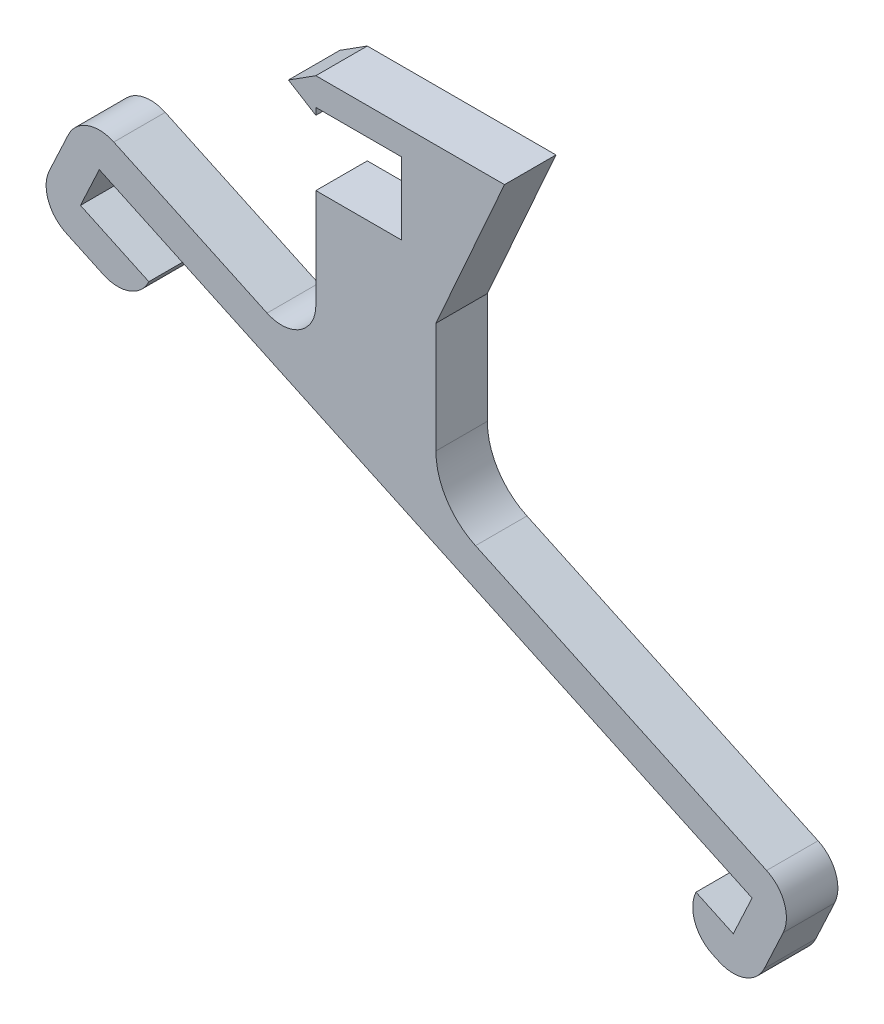
from build123d import *

# Parameters (mm, degrees)
BOSS_EXTRUDE1_DEPTH = 15
FILLET1_R           = 10
FILLET2_R           = 20


with BuildPart() as part:
    # Sketch1 → Boss-Extrude1 (new body)
    with BuildSketch(Plane.XY):
        Polygon((0, 0), (-25, 0), (-25, -2), (-33, 2.914001084), (-25, 8), (10, 8), (30, 8), (10, -37), (10, -82), (115.477706991, -131.185062534), (101.531304353, -161.093219507), (81.592533038, -151.795617748), (85.818715656, -142.732539878), (96.6944091, -147.803959019), (102.188446503, -136.021957787), (-88.136188775, -47.272122822), (-93.630226177, -59.054124053), (-73.691454863, -68.351725812), (-77.91763748, -77.414803682), (-106.919486665, -63.891019306), (-92.973084028, -33.982862334), (-25, -65.679231965), (-25, -21), (0, -21), align=None)
    extrude(amount=BOSS_EXTRUDE1_DEPTH)

    # Fillet1
    fillet1_edges = [part.edges().sort_by_distance(p)[0] for p in [
        (115.477706991, -131.185062534, 7.5),
        (101.531304353, -161.093219507, 7.5),
        (81.592533038, -151.795617748, 7.5),
        (-77.91763748, -77.414803682, 7.5),
        (-106.919486665, -63.891019306, 7.5),
        (-92.973084028, -33.982862334, 7.5),
        (-25, -65.679231965, 7.5),
    ]]
    fillet(fillet1_edges, radius=FILLET1_R - 0.0001)  # a hair under: the kernel refuses the full size

    # Fillet2
    fillet2_edges = [part.edges().sort_by_distance(p)[0] for p in [
        (10, -82, 7.5),
    ]]
    fillet(fillet2_edges, radius=FILLET2_R)


solid = part.part
